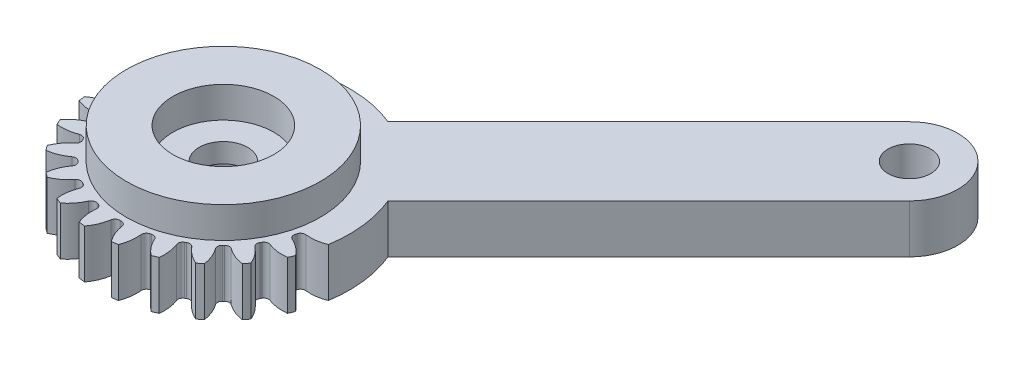
from build123d import *

# Parameters (mm, degrees)
SKETCH2_R                = 13
SKETCH2_R_2              = 5.2
BOSS_EXTRUDE1_DEPTH      = 5
CUT_EXTRUDE1_DEPTH       = 20.052558883
FILLET1_R                = 0.5
CIRPATTERN1_COUNT        = 24
FILLET1_OF_CIRPATTERN1_R = 0.5
EXTRUDE_START            = -5
EXTRUDE_1_OUTLINE_R      = 2.2
EXTRUDE_1_DEPTH          = 5
SKETCH_5_R               = 10
SKETCH_5_R_2             = 5.2
EXTRUDE_2_DEPTH          = 3.2
SKETCH_6_R               = 6
CUT_EXTRUDE_1_DEPTH      = 3
SKETCH_7_R               = 5.2
SKETCH_7_R_2             = 2.5
EXTRUDE_3_DEPTH          = 2


# Read off the part's stored shape, not the designer's step: 凸台-拉伸1
with BuildPart() as part:
    # Sketch2 → Boss-Extrude1 (new body)
    with BuildSketch(Plane(origin=(0, 0, 0), x_dir=(1, 0, 0), z_dir=(0, 1, 0))):
        with Locations(Location((0, 0, 0), (0, 0, 270))):
            Circle(SKETCH2_R)
        with Locations(Location((0, 0, 0), (0, 0, 270))):
            Circle(SKETCH2_R_2, mode=Mode.SUBTRACT)
    extrude(amount=BOSS_EXTRUDE1_DEPTH)

    # Sketch3 → Cut-Extrude1 (cut, through all)
    with BuildSketch(Plane(origin=(0, 5, 0), x_dir=(1, 0, 0), z_dir=(0, 1, 0))):
        with BuildLine():
            ThreePointArc((0.527459192, 10.586868602), (0, 10.6), (-0.527459192, 10.586868602))
            ThreePointArc((-0.527459192, 10.586868602), (-0.776880215, 11.820955553), (-1.379068427, 12.926645747))
            ThreePointArc((-1.379068427, 12.926645747), (0, 13), (1.379068427, 12.926645747))
            ThreePointArc((1.379068427, 12.926645747), (0.776880215, 11.820955553), (0.527459192, 10.586868602))
        make_face()
    cut_extrude1 = extrude(amount=-CUT_EXTRUDE1_DEPTH, mode=Mode.SUBTRACT)

    # Fillet1
    fillet1_edges = [part.edges().sort_by_distance(p)[0] for p in [
        (-0.527459192, 2.5, -10.586868602),
        (0.527459192, 2.5, -10.586868602),
    ]]
    fillet(fillet1_edges, radius=FILLET1_R)

    # CirPattern1: Cut-Extrude1 ×24 about axis
    cirpattern1_axis = Axis((0, 0, 0), (0, 1, 0))
    for i in range(1, CIRPATTERN1_COUNT):
        add(cut_extrude1.rotate(cirpattern1_axis, i * 360 / CIRPATTERN1_COUNT), mode=Mode.SUBTRACT)

    # Fillet1 of CirPattern1
    fillet1_of_cirpattern1_edges = [part.edges().sort_by_distance(p)[0] for p in [
        (-3.249569678, 2.5, -10.089613318),
        (-2.230596767, 2.5, -10.362646287),
        (-5.750227361, 2.5, -8.90476756),
        (-4.836641242, 2.5, -9.432226752),
        (-7.859016551, 2.5, -7.113076609),
        (-7.113076609, 2.5, -7.859016551),
        (-9.432226752, 2.5, -4.836641242),
        (-8.90476756, 2.5, -5.750227361),
        (-10.362646287, 2.5, -2.230596767),
        (-10.089613318, 2.5, -3.249569678),
        (-10.586868602, 2.5, 0.527459192),
        (-10.586868602, 2.5, -0.527459192),
        (-10.089613318, 2.5, 3.249569678),
        (-10.362646287, 2.5, 2.230596767),
        (-8.90476756, 2.5, 5.750227361),
        (-9.432226752, 2.5, 4.836641242),
        (-7.113076609, 2.5, 7.859016551),
        (-7.859016551, 2.5, 7.113076609),
        (-4.836641242, 2.5, 9.432226752),
        (-5.750227361, 2.5, 8.90476756),
        (-2.230596767, 2.5, 10.362646287),
        (-3.249569678, 2.5, 10.089613318),
        (0.527459192, 2.5, 10.586868602),
        (-0.527459192, 2.5, 10.586868602),
        (3.249569678, 2.5, 10.089613318),
        (2.230596767, 2.5, 10.362646287),
        (5.750227361, 2.5, 8.90476756),
        (4.836641242, 2.5, 9.432226752),
        (7.859016551, 2.5, 7.113076609),
        (7.113076609, 2.5, 7.859016551),
        (9.432226752, 2.5, 4.836641242),
        (8.90476756, 2.5, 5.750227361),
        (10.362646287, 2.5, 2.230596767),
        (10.089613318, 2.5, 3.249569678),
        (10.586868602, 2.5, -0.527459192),
        (10.586868602, 2.5, 0.527459192),
        (10.089613318, 2.5, -3.249569678),
        (10.362646287, 2.5, -2.230596767),
        (8.90476756, 2.5, -5.750227361),
        (9.432226752, 2.5, -4.836641242),
        (7.113076609, 2.5, -7.859016551),
        (7.859016551, 2.5, -7.113076609),
        (4.836641242, 2.5, -9.432226752),
        (5.750227361, 2.5, -8.90476756),
        (2.230596767, 2.5, -10.362646287),
        (3.249569678, 2.5, -10.089613318),
    ]]
    fillet(fillet1_of_cirpattern1_edges, radius=FILLET1_OF_CIRPATTERN1_R)

    # 凸台-拉伸1 outline → 凸台-拉伸1 (add)
    # profile 1 of 5: a face of its own
    with BuildSketch(Plane(origin=(0, 5, 0), x_dir=(1, 0, 0), z_dir=(0, 1, 0)).offset(EXTRUDE_START)):
        with BuildLine():
            ThreePointArc((12.926645747, -1.379068427), (13, 0), (12.926645747, 1.379068427))
            ThreePointArc((12.926645747, 1.379068427), (12.025072485, 0.857236447), (11.02318205, 0.572002303))
            ThreePointArc((11.02318205, 0.572002303), (10.718934665, 0.401929215), (10.599738984, 0.074387285))
            ThreePointArc((10.599738984, 0.074387285), (10.6, 0), (10.599738984, -0.074387285))
            ThreePointArc((10.599738984, -0.074387285), (10.718934665, -0.401929215), (11.02318205, -0.572002303))
            ThreePointArc((11.02318205, -0.572002303), (12.025072485, -0.857236447), (12.926645747, -1.379068427))
        make_face()
    # profile 2 of 5: a face of its own
    with BuildSketch(Plane(origin=(0, 5, 0), x_dir=(1, 0, 0), z_dir=(0, 1, 0)).offset(EXTRUDE_START)):
        with BuildLine():
            ThreePointArc((12.843110147, 2.013584299), (12.557035741, 3.364647587), (12.129251801, 4.677739919))
            ThreePointArc((12.129251801, 4.677739919), (11.393458958, 3.940344601), (10.49953114, 3.405521249))
            ThreePointArc((10.49953114, 3.405521249), (10.249668888, 3.162498244), (10.219308791, 2.815266922))
            ThreePointArc((10.219308791, 2.815266922), (10.238813759, 2.743481878), (10.257814483, 2.671561723))
            ThreePointArc((10.257814483, 2.671561723), (10.457722759, 2.386030625), (10.79562132, 2.300497655))
            ThreePointArc((10.79562132, 2.300497655), (11.837197196, 2.284290955), (12.843110147, 2.013584299))
        make_face()
    # profile 3 of 5: a face of its own
    with BuildSketch(Plane(origin=(0, 5, 0), x_dir=(1, 0, 0), z_dir=(0, 1, 0)).offset(EXTRUDE_START)):
        with BuildLine():
            ThreePointArc((11.884337816, 5.269014582), (11.9536425, 5.109836689), (12.020815281, 4.949747468))
            Line((12.020815281, 4.949747468), (38.890872965, 31.819805153))
            ThreePointArc((38.890872965, 31.819805153), (38.890872965, 38.890872965), (31.819805153, 38.890872965))
            Line((31.819805153, 38.890872965), (4.949747468, 12.020815281))
            ThreePointArc((4.949747468, 12.020815281), (5.109836689, 11.9536425), (5.269014582, 11.884337816))
            ThreePointArc((5.269014582, 11.884337816), (5.270147703, 10.842636478), (5.0162225, 9.832356838))
            ThreePointArc((5.0162225, 9.832356838), (5.011386422, 9.483834329), (5.235448214, 9.216836876))
            ThreePointArc((5.235448214, 9.216836876), (5.3, 9.17986928), (5.364290771, 9.142449591))
            ThreePointArc((5.364290771, 9.142449591), (5.707548244, 9.081905114), (6.006959551, 9.260354535))
            ThreePointArc((6.006959551, 9.260354535), (6.754924783, 9.985400031), (7.657631165, 10.505269389))
            ThreePointArc((7.657631165, 10.505269389), (7.913898577, 10.313593424), (8.165370229, 10.115667502))
            ThreePointArc((8.165370229, 10.115667502), (7.896852594, 9.109168003), (7.390100071, 8.199033485))
            ThreePointArc((7.390100071, 8.199033485), (7.295224515, 7.863638262), (7.442547561, 7.547747068))
            ThreePointArc((7.442547561, 7.547747068), (7.495331881, 7.495331881), (7.547747068, 7.442547561))
            ThreePointArc((7.547747068, 7.442547561), (7.863638262, 7.295224515), (8.199033485, 7.390100071))
            ThreePointArc((8.199033485, 7.390100071), (9.109168003, 7.896852594), (10.115667502, 8.165370229))
            ThreePointArc((10.115667502, 8.165370229), (10.313593424, 7.913898577), (10.505269389, 7.657631165))
            ThreePointArc((10.505269389, 7.657631165), (9.985400031, 6.754924783), (9.260354535, 6.006959551))
            ThreePointArc((9.260354535, 6.006959551), (9.081905114, 5.707548244), (9.142449591, 5.364290771))
            ThreePointArc((9.142449591, 5.364290771), (9.17986928, 5.3), (9.216836876, 5.235448214))
            ThreePointArc((9.216836876, 5.235448214), (9.483834329, 5.011386422), (9.832356838, 5.0162225))
            ThreePointArc((9.832356838, 5.0162225), (10.842636478, 5.270147703), (11.884337816, 5.269014582))
        make_face()
        with Locations((35.355339059, 35.355339059)):
            Circle(EXTRUDE_1_OUTLINE_R, mode=Mode.SUBTRACT)
    # profile 4 of 5: a face of its own
    with BuildSketch(Plane(origin=(0, 5, 0), x_dir=(1, 0, 0), z_dir=(0, 1, 0)).offset(EXTRUDE_START)):
        with BuildLine():
            ThreePointArc((0.572002303, 11.02318205), (0.857236447, 12.025072485), (1.379068427, 12.926645747))
            ThreePointArc((1.379068427, 12.926645747), (0, 13), (-1.379068427, 12.926645747))
            ThreePointArc((-1.379068427, 12.926645747), (-0.857236447, 12.025072485), (-0.572002303, 11.02318205))
            ThreePointArc((-0.572002303, 11.02318205), (-0.401929215, 10.718934665), (-0.074387285, 10.599738984))
            ThreePointArc((-0.074387285, 10.599738984), (0, 10.6), (0.074387285, 10.599738984))
            ThreePointArc((0.074387285, 10.599738984), (0.401929215, 10.718934665), (0.572002303, 11.02318205))
        make_face()
    # profile 5 of 5: a face of its own
    with BuildSketch(Plane(origin=(0, 5, 0), x_dir=(1, 0, 0), z_dir=(0, 1, 0)).offset(EXTRUDE_START)):
        with BuildLine():
            ThreePointArc((3.405521249, 10.49953114), (3.940344601, 11.393458958), (4.677739919, 12.129251801))
            ThreePointArc((4.677739919, 12.129251801), (3.364647587, 12.557035741), (2.013584299, 12.843110147))
            ThreePointArc((2.013584299, 12.843110147), (2.284290955, 11.837197196), (2.300497655, 10.79562132))
            ThreePointArc((2.300497655, 10.79562132), (2.386030625, 10.457722759), (2.671561723, 10.257814483))
            ThreePointArc((2.671561723, 10.257814483), (2.743481878, 10.238813759), (2.815266922, 10.219308791))
            ThreePointArc((2.815266922, 10.219308791), (3.162498244, 10.249668888), (3.405521249, 10.49953114))
        make_face()
    extrude(amount=EXTRUDE_1_DEPTH)

    # 草图5 → 凸台-拉伸2 (add)
    with BuildSketch(Plane(origin=(0, 5, 0), x_dir=(1, 0, 0), z_dir=(0, 1, 0))):
        with Locations(Location((0, 0, 0), (0, 0, 270))):
            Circle(SKETCH_5_R)
        with Locations(Location((0, 0, 0), (0, 0, 270))):
            Circle(SKETCH_5_R_2, mode=Mode.SUBTRACT)
    extrude(amount=EXTRUDE_2_DEPTH)

    # 草图6 → 切除-拉伸1 (cut)
    with BuildSketch(Plane.XZ):
        with Locations(Location((0, 0, 0), (0, 0, 270))):
            Circle(SKETCH_6_R)
    extrude(amount=-CUT_EXTRUDE_1_DEPTH, mode=Mode.SUBTRACT)

    # 草图7 → 凸台-拉伸3 (add)
    with BuildSketch(Plane.XZ.offset(-3)):
        with Locations(Location((0, 0, 0), (0, 0, 270))):
            Circle(SKETCH_7_R)
        with Locations(Location((0, 0, 0), (0, 0, 270))):
            Circle(SKETCH_7_R_2, mode=Mode.SUBTRACT)
    extrude(amount=-EXTRUDE_3_DEPTH)


solid = part.part
